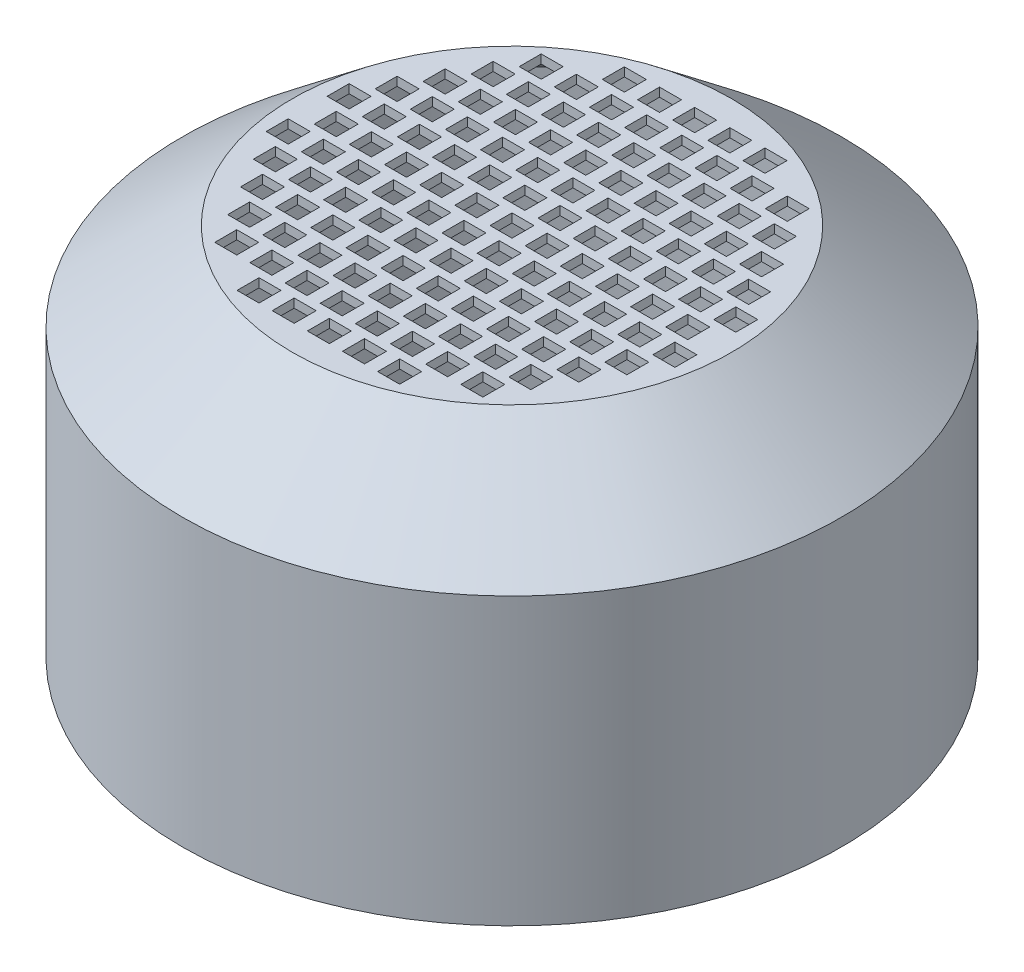
from build123d import *

# Parameters (mm, degrees)
SKETCH1_R               = 1905
BOSS_EXTRUDE1_DEPTH     = 2159
CHAMFER1_SIZE           = 508
CHAMFER1_SIZE2          = 635
SHELL1_T                = -50.8
SKETCH2_W               = 127
SKETCH2_H               = 127
CUT_EXTRUDE1_DEPTH      = 3453.438413643
FILL_START              = 2108.2
FILL_PATTERN1_OUTLINE_W = 127
FILL_PATTERN1_OUTLINE_H = 127
FILL_PATTERN1_DEPTH     = 50.8
EXTRUDE_THIN1_REACH     = 3454.438
SKETCH3_R               = 1689.1
SKETCH3_R_2             = 1651
SCALE1_SCALE            = 0.02


# Read off the part's stored shape, not the designer's step: Fill Pattern1
with BuildPart() as part:
    # Sketch1 → Boss-Extrude1 (new body)
    with BuildSketch(Plane(origin=(0, 0, 0), x_dir=(1, 0, 0), z_dir=(0, 1, 0))):
        with Locations(Location((0, 0, 0), (0, 0, 270))):
            Circle(SKETCH1_R)
    extrude(amount=BOSS_EXTRUDE1_DEPTH)

    # Chamfer1
    chamfer1_edges = [part.edges().sort_by_distance(p)[0] for p in [
        (0, 2159, -1905),
    ]]
    chamfer1_side = [part.faces().sort_by_distance(p)[0] for p in [
        (0, 1079.5, -1905),
    ]]
    chamfer(chamfer1_edges, length=CHAMFER1_SIZE, length2=CHAMFER1_SIZE2, reference=chamfer1_side[0])

    # Shell1
    shell1_openings = [part.faces().sort_by_distance(p)[0] for p in [
        (0, 0, 0),
    ]]
    offset(amount=SHELL1_T, openings=shell1_openings, kind=Kind.INTERSECTION)

    # Sketch2 → Cut-Extrude1 (cut, through all)
    with BuildSketch(Plane(origin=(0, 2159, 0), x_dir=(1, 0, 0), z_dir=(0, 1, 0))):
        Rectangle(SKETCH2_W, SKETCH2_H)
    extrude(amount=-CUT_EXTRUDE1_DEPTH, mode=Mode.SUBTRACT)

    # Fill Pattern1 outline → Fill Pattern1 (cut)
    with BuildSketch(Plane(origin=(0, 0, 0), x_dir=(1, 0, 0), z_dir=(0, 1, 0)).offset(FILL_START)):
        with Locations((0, 1055.858172294)):
            Rectangle(FILL_PATTERN1_OUTLINE_W, FILL_PATTERN1_OUTLINE_H)
        with Locations((0, 351.952724098)):
            Rectangle(FILL_PATTERN1_OUTLINE_W, FILL_PATTERN1_OUTLINE_H)
        with Locations((0, 703.905448196)):
            Rectangle(FILL_PATTERN1_OUTLINE_W, FILL_PATTERN1_OUTLINE_H)
        with Locations((0, -1055.858172294)):
            Rectangle(FILL_PATTERN1_OUTLINE_W, FILL_PATTERN1_OUTLINE_H)
        with Locations((0, -351.952724098)):
            Rectangle(FILL_PATTERN1_OUTLINE_W, FILL_PATTERN1_OUTLINE_H)
        with Locations((0, -703.905448196)):
            Rectangle(FILL_PATTERN1_OUTLINE_W, FILL_PATTERN1_OUTLINE_H)
        with Locations((-406.4, 0)):
            Rectangle(FILL_PATTERN1_OUTLINE_W, FILL_PATTERN1_OUTLINE_H)
        with Locations((-609.6, 0)):
            Rectangle(FILL_PATTERN1_OUTLINE_W, FILL_PATTERN1_OUTLINE_H)
        with Locations((-203.2, 0)):
            Rectangle(FILL_PATTERN1_OUTLINE_W, FILL_PATTERN1_OUTLINE_H)
        with Locations((-1016, 0)):
            Rectangle(FILL_PATTERN1_OUTLINE_W, FILL_PATTERN1_OUTLINE_H)
        with Locations((-812.8, 0)):
            Rectangle(FILL_PATTERN1_OUTLINE_W, FILL_PATTERN1_OUTLINE_H)
        with Locations((609.6, 0)):
            Rectangle(FILL_PATTERN1_OUTLINE_W, FILL_PATTERN1_OUTLINE_H)
        with Locations((1016, 0)):
            Rectangle(FILL_PATTERN1_OUTLINE_W, FILL_PATTERN1_OUTLINE_H)
        with Locations((812.8, 0)):
            Rectangle(FILL_PATTERN1_OUTLINE_W, FILL_PATTERN1_OUTLINE_H)
        with Locations((406.4, 0)):
            Rectangle(FILL_PATTERN1_OUTLINE_W, FILL_PATTERN1_OUTLINE_H)
        with Locations((203.2, 0)):
            Rectangle(FILL_PATTERN1_OUTLINE_W, FILL_PATTERN1_OUTLINE_H)
        with Locations((1117.6, -175.976362049)):
            Rectangle(FILL_PATTERN1_OUTLINE_W, FILL_PATTERN1_OUTLINE_H)
        with Locations((1117.6, 175.976362049)):
            Rectangle(FILL_PATTERN1_OUTLINE_W, FILL_PATTERN1_OUTLINE_H)
        with Locations((-508, -175.976362049)):
            Rectangle(FILL_PATTERN1_OUTLINE_W, FILL_PATTERN1_OUTLINE_H)
        with Locations((-711.2, -175.976362049)):
            Rectangle(FILL_PATTERN1_OUTLINE_W, FILL_PATTERN1_OUTLINE_H)
        with Locations((-304.8, -175.976362049)):
            Rectangle(FILL_PATTERN1_OUTLINE_W, FILL_PATTERN1_OUTLINE_H)
        with Locations((-1117.6, -175.976362049)):
            Rectangle(FILL_PATTERN1_OUTLINE_W, FILL_PATTERN1_OUTLINE_H)
        with Locations((-914.4, -175.976362049)):
            Rectangle(FILL_PATTERN1_OUTLINE_W, FILL_PATTERN1_OUTLINE_H)
        with Locations((508, -175.976362049)):
            Rectangle(FILL_PATTERN1_OUTLINE_W, FILL_PATTERN1_OUTLINE_H)
        with Locations((914.4, -175.976362049)):
            Rectangle(FILL_PATTERN1_OUTLINE_W, FILL_PATTERN1_OUTLINE_H)
        with Locations((711.2, -175.976362049)):
            Rectangle(FILL_PATTERN1_OUTLINE_W, FILL_PATTERN1_OUTLINE_H)
        with Locations((101.6, -175.976362049)):
            Rectangle(FILL_PATTERN1_OUTLINE_W, FILL_PATTERN1_OUTLINE_H)
        with Locations((-101.6, -175.976362049)):
            Rectangle(FILL_PATTERN1_OUTLINE_W, FILL_PATTERN1_OUTLINE_H)
        with Locations((304.8, -175.976362049)):
            Rectangle(FILL_PATTERN1_OUTLINE_W, FILL_PATTERN1_OUTLINE_H)
        with Locations((-609.6, -351.952724098)):
            Rectangle(FILL_PATTERN1_OUTLINE_W, FILL_PATTERN1_OUTLINE_H)
        with Locations((-609.6, -703.905448196)):
            Rectangle(FILL_PATTERN1_OUTLINE_W, FILL_PATTERN1_OUTLINE_H)
        with Locations((-609.6, 351.952724098)):
            Rectangle(FILL_PATTERN1_OUTLINE_W, FILL_PATTERN1_OUTLINE_H)
        with Locations((-609.6, 703.905448196)):
            Rectangle(FILL_PATTERN1_OUTLINE_W, FILL_PATTERN1_OUTLINE_H)
        with Locations((-812.8, -351.952724098)):
            Rectangle(FILL_PATTERN1_OUTLINE_W, FILL_PATTERN1_OUTLINE_H)
        with Locations((-406.4, -351.952724098)):
            Rectangle(FILL_PATTERN1_OUTLINE_W, FILL_PATTERN1_OUTLINE_H)
        with Locations((-1016, -351.952724098)):
            Rectangle(FILL_PATTERN1_OUTLINE_W, FILL_PATTERN1_OUTLINE_H)
        with Locations((609.6, -351.952724098)):
            Rectangle(FILL_PATTERN1_OUTLINE_W, FILL_PATTERN1_OUTLINE_H)
        with Locations((406.4, -351.952724098)):
            Rectangle(FILL_PATTERN1_OUTLINE_W, FILL_PATTERN1_OUTLINE_H)
        with Locations((812.8, -351.952724098)):
            Rectangle(FILL_PATTERN1_OUTLINE_W, FILL_PATTERN1_OUTLINE_H)
        with Locations((1016, -351.952724098)):
            Rectangle(FILL_PATTERN1_OUTLINE_W, FILL_PATTERN1_OUTLINE_H)
        with Locations((-203.2, -351.952724098)):
            Rectangle(FILL_PATTERN1_OUTLINE_W, FILL_PATTERN1_OUTLINE_H)
        with Locations((203.2, -351.952724098)):
            Rectangle(FILL_PATTERN1_OUTLINE_W, FILL_PATTERN1_OUTLINE_H)
        with Locations((-711.2, -527.929086147)):
            Rectangle(FILL_PATTERN1_OUTLINE_W, FILL_PATTERN1_OUTLINE_H)
        with Locations((-711.2, -879.881810245)):
            Rectangle(FILL_PATTERN1_OUTLINE_W, FILL_PATTERN1_OUTLINE_H)
        with Locations((-711.2, 879.881810245)):
            Rectangle(FILL_PATTERN1_OUTLINE_W, FILL_PATTERN1_OUTLINE_H)
        with Locations((-711.2, 175.976362049)):
            Rectangle(FILL_PATTERN1_OUTLINE_W, FILL_PATTERN1_OUTLINE_H)
        with Locations((-711.2, 527.929086147)):
            Rectangle(FILL_PATTERN1_OUTLINE_W, FILL_PATTERN1_OUTLINE_H)
        with Locations((-508, -527.929086147)):
            Rectangle(FILL_PATTERN1_OUTLINE_W, FILL_PATTERN1_OUTLINE_H)
        with Locations((-914.4, -527.929086147)):
            Rectangle(FILL_PATTERN1_OUTLINE_W, FILL_PATTERN1_OUTLINE_H)
        with Locations((508, -527.929086147)):
            Rectangle(FILL_PATTERN1_OUTLINE_W, FILL_PATTERN1_OUTLINE_H)
        with Locations((304.8, -527.929086147)):
            Rectangle(FILL_PATTERN1_OUTLINE_W, FILL_PATTERN1_OUTLINE_H)
        with Locations((914.4, -527.929086147)):
            Rectangle(FILL_PATTERN1_OUTLINE_W, FILL_PATTERN1_OUTLINE_H)
        with Locations((711.2, -527.929086147)):
            Rectangle(FILL_PATTERN1_OUTLINE_W, FILL_PATTERN1_OUTLINE_H)
        with Locations((-101.6, -527.929086147)):
            Rectangle(FILL_PATTERN1_OUTLINE_W, FILL_PATTERN1_OUTLINE_H)
        with Locations((-304.8, -527.929086147)):
            Rectangle(FILL_PATTERN1_OUTLINE_W, FILL_PATTERN1_OUTLINE_H)
        with Locations((101.6, -527.929086147)):
            Rectangle(FILL_PATTERN1_OUTLINE_W, FILL_PATTERN1_OUTLINE_H)
        with Locations((-812.8, -703.905448196)):
            Rectangle(FILL_PATTERN1_OUTLINE_W, FILL_PATTERN1_OUTLINE_H)
        with Locations((-812.8, 703.905448196)):
            Rectangle(FILL_PATTERN1_OUTLINE_W, FILL_PATTERN1_OUTLINE_H)
        with Locations((-812.8, 351.952724098)):
            Rectangle(FILL_PATTERN1_OUTLINE_W, FILL_PATTERN1_OUTLINE_H)
        with Locations((406.4, -703.905448196)):
            Rectangle(FILL_PATTERN1_OUTLINE_W, FILL_PATTERN1_OUTLINE_H)
        with Locations((203.2, -703.905448196)):
            Rectangle(FILL_PATTERN1_OUTLINE_W, FILL_PATTERN1_OUTLINE_H)
        with Locations((812.8, -703.905448196)):
            Rectangle(FILL_PATTERN1_OUTLINE_W, FILL_PATTERN1_OUTLINE_H)
        with Locations((609.6, -703.905448196)):
            Rectangle(FILL_PATTERN1_OUTLINE_W, FILL_PATTERN1_OUTLINE_H)
        with Locations((-203.2, -703.905448196)):
            Rectangle(FILL_PATTERN1_OUTLINE_W, FILL_PATTERN1_OUTLINE_H)
        with Locations((-406.4, -703.905448196)):
            Rectangle(FILL_PATTERN1_OUTLINE_W, FILL_PATTERN1_OUTLINE_H)
        with Locations((406.4, 1055.858172294)):
            Rectangle(FILL_PATTERN1_OUTLINE_W, FILL_PATTERN1_OUTLINE_H)
        with Locations((203.2, 1055.858172294)):
            Rectangle(FILL_PATTERN1_OUTLINE_W, FILL_PATTERN1_OUTLINE_H)
        with Locations((-203.2, 1055.858172294)):
            Rectangle(FILL_PATTERN1_OUTLINE_W, FILL_PATTERN1_OUTLINE_H)
        with Locations((-406.4, 1055.858172294)):
            Rectangle(FILL_PATTERN1_OUTLINE_W, FILL_PATTERN1_OUTLINE_H)
        with Locations((-508, 175.976362049)):
            Rectangle(FILL_PATTERN1_OUTLINE_W, FILL_PATTERN1_OUTLINE_H)
        with Locations((-508, 527.929086147)):
            Rectangle(FILL_PATTERN1_OUTLINE_W, FILL_PATTERN1_OUTLINE_H)
        with Locations((-508, 879.881810245)):
            Rectangle(FILL_PATTERN1_OUTLINE_W, FILL_PATTERN1_OUTLINE_H)
        with Locations((-508, -879.881810245)):
            Rectangle(FILL_PATTERN1_OUTLINE_W, FILL_PATTERN1_OUTLINE_H)
        with Locations((-406.4, 351.952724098)):
            Rectangle(FILL_PATTERN1_OUTLINE_W, FILL_PATTERN1_OUTLINE_H)
        with Locations((-406.4, 703.905448196)):
            Rectangle(FILL_PATTERN1_OUTLINE_W, FILL_PATTERN1_OUTLINE_H)
        with Locations((-406.4, -1055.858172294)):
            Rectangle(FILL_PATTERN1_OUTLINE_W, FILL_PATTERN1_OUTLINE_H)
        with Locations((-304.8, 175.976362049)):
            Rectangle(FILL_PATTERN1_OUTLINE_W, FILL_PATTERN1_OUTLINE_H)
        with Locations((-304.8, 527.929086147)):
            Rectangle(FILL_PATTERN1_OUTLINE_W, FILL_PATTERN1_OUTLINE_H)
        with Locations((-304.8, 879.881810245)):
            Rectangle(FILL_PATTERN1_OUTLINE_W, FILL_PATTERN1_OUTLINE_H)
        with Locations((-304.8, -879.881810245)):
            Rectangle(FILL_PATTERN1_OUTLINE_W, FILL_PATTERN1_OUTLINE_H)
        with Locations((-101.6, 175.976362049)):
            Rectangle(FILL_PATTERN1_OUTLINE_W, FILL_PATTERN1_OUTLINE_H)
        with Locations((-1117.6, 175.976362049)):
            Rectangle(FILL_PATTERN1_OUTLINE_W, FILL_PATTERN1_OUTLINE_H)
        with Locations((-914.4, 175.976362049)):
            Rectangle(FILL_PATTERN1_OUTLINE_W, FILL_PATTERN1_OUTLINE_H)
        with Locations((711.2, 175.976362049)):
            Rectangle(FILL_PATTERN1_OUTLINE_W, FILL_PATTERN1_OUTLINE_H)
        with Locations((914.4, 175.976362049)):
            Rectangle(FILL_PATTERN1_OUTLINE_W, FILL_PATTERN1_OUTLINE_H)
        with Locations((101.6, 175.976362049)):
            Rectangle(FILL_PATTERN1_OUTLINE_W, FILL_PATTERN1_OUTLINE_H)
        with Locations((508, 175.976362049)):
            Rectangle(FILL_PATTERN1_OUTLINE_W, FILL_PATTERN1_OUTLINE_H)
        with Locations((304.8, 175.976362049)):
            Rectangle(FILL_PATTERN1_OUTLINE_W, FILL_PATTERN1_OUTLINE_H)
        with Locations((-203.2, 351.952724098)):
            Rectangle(FILL_PATTERN1_OUTLINE_W, FILL_PATTERN1_OUTLINE_H)
        with Locations((-203.2, 703.905448196)):
            Rectangle(FILL_PATTERN1_OUTLINE_W, FILL_PATTERN1_OUTLINE_H)
        with Locations((-203.2, -1055.858172294)):
            Rectangle(FILL_PATTERN1_OUTLINE_W, FILL_PATTERN1_OUTLINE_H)
        with Locations((-1016, 351.952724098)):
            Rectangle(FILL_PATTERN1_OUTLINE_W, FILL_PATTERN1_OUTLINE_H)
        with Locations((812.8, 351.952724098)):
            Rectangle(FILL_PATTERN1_OUTLINE_W, FILL_PATTERN1_OUTLINE_H)
        with Locations((1016, 351.952724098)):
            Rectangle(FILL_PATTERN1_OUTLINE_W, FILL_PATTERN1_OUTLINE_H)
        with Locations((203.2, 351.952724098)):
            Rectangle(FILL_PATTERN1_OUTLINE_W, FILL_PATTERN1_OUTLINE_H)
        with Locations((609.6, 351.952724098)):
            Rectangle(FILL_PATTERN1_OUTLINE_W, FILL_PATTERN1_OUTLINE_H)
        with Locations((406.4, 351.952724098)):
            Rectangle(FILL_PATTERN1_OUTLINE_W, FILL_PATTERN1_OUTLINE_H)
        with Locations((-101.6, 879.881810245)):
            Rectangle(FILL_PATTERN1_OUTLINE_W, FILL_PATTERN1_OUTLINE_H)
        with Locations((-101.6, 527.929086147)):
            Rectangle(FILL_PATTERN1_OUTLINE_W, FILL_PATTERN1_OUTLINE_H)
        with Locations((-101.6, -879.881810245)):
            Rectangle(FILL_PATTERN1_OUTLINE_W, FILL_PATTERN1_OUTLINE_H)
        with Locations((304.8, 879.881810245)):
            Rectangle(FILL_PATTERN1_OUTLINE_W, FILL_PATTERN1_OUTLINE_H)
        with Locations((101.6, 879.881810245)):
            Rectangle(FILL_PATTERN1_OUTLINE_W, FILL_PATTERN1_OUTLINE_H)
        with Locations((508, 879.881810245)):
            Rectangle(FILL_PATTERN1_OUTLINE_W, FILL_PATTERN1_OUTLINE_H)
        with Locations((711.2, 879.881810245)):
            Rectangle(FILL_PATTERN1_OUTLINE_W, FILL_PATTERN1_OUTLINE_H)
        with Locations((203.2, 703.905448196)):
            Rectangle(FILL_PATTERN1_OUTLINE_W, FILL_PATTERN1_OUTLINE_H)
        with Locations((812.8, 703.905448196)):
            Rectangle(FILL_PATTERN1_OUTLINE_W, FILL_PATTERN1_OUTLINE_H)
        with Locations((406.4, 703.905448196)):
            Rectangle(FILL_PATTERN1_OUTLINE_W, FILL_PATTERN1_OUTLINE_H)
        with Locations((609.6, 703.905448196)):
            Rectangle(FILL_PATTERN1_OUTLINE_W, FILL_PATTERN1_OUTLINE_H)
        with Locations((101.6, 527.929086147)):
            Rectangle(FILL_PATTERN1_OUTLINE_W, FILL_PATTERN1_OUTLINE_H)
        with Locations((-914.4, 527.929086147)):
            Rectangle(FILL_PATTERN1_OUTLINE_W, FILL_PATTERN1_OUTLINE_H)
        with Locations((914.4, 527.929086147)):
            Rectangle(FILL_PATTERN1_OUTLINE_W, FILL_PATTERN1_OUTLINE_H)
        with Locations((304.8, 527.929086147)):
            Rectangle(FILL_PATTERN1_OUTLINE_W, FILL_PATTERN1_OUTLINE_H)
        with Locations((711.2, 527.929086147)):
            Rectangle(FILL_PATTERN1_OUTLINE_W, FILL_PATTERN1_OUTLINE_H)
        with Locations((508, 527.929086147)):
            Rectangle(FILL_PATTERN1_OUTLINE_W, FILL_PATTERN1_OUTLINE_H)
        with Locations((406.4, -1055.858172294)):
            Rectangle(FILL_PATTERN1_OUTLINE_W, FILL_PATTERN1_OUTLINE_H)
        with Locations((304.8, -879.881810245)):
            Rectangle(FILL_PATTERN1_OUTLINE_W, FILL_PATTERN1_OUTLINE_H)
        with Locations((203.2, -1055.858172294)):
            Rectangle(FILL_PATTERN1_OUTLINE_W, FILL_PATTERN1_OUTLINE_H)
        with Locations((101.6, -879.881810245)):
            Rectangle(FILL_PATTERN1_OUTLINE_W, FILL_PATTERN1_OUTLINE_H)
        with Locations((711.2, -879.881810245)):
            Rectangle(FILL_PATTERN1_OUTLINE_W, FILL_PATTERN1_OUTLINE_H)
        with Locations((508, -879.881810245)):
            Rectangle(FILL_PATTERN1_OUTLINE_W, FILL_PATTERN1_OUTLINE_H)
    extrude(amount=FILL_PATTERN1_DEPTH, mode=Mode.SUBTRACT)

    # Extrude-Thin1: up to this cone (the profile starts inside it)
    extrude_thin1_end = Plane(origin=(0, 0, 0), z_dir=(0, -1, 0)).offset(-3109.944256748) * Cone(1.25e-06, 13065.390724915, 10452.312578932, align=(Align.CENTER, Align.CENTER, Align.MIN), mode=Mode.PRIVATE)
    # Sketch3 → Extrude-Thin1 (add, up to the surface)
    with BuildSketch(Plane.XZ, mode=Mode.PRIVATE) as extrude_thin1_sk1:
        Circle(SKETCH3_R)
        Circle(SKETCH3_R_2, mode=Mode.SUBTRACT)
    extrude_thin1_tool1 = extrude(extrude_thin1_sk1.sketch, amount=-EXTRUDE_THIN1_REACH, mode=Mode.PRIVATE) & extrude_thin1_end
    add(extrude_thin1_tool1.solids().sort_by_distance((-1684.322504, 0, 0))[0])


with BuildPart() as part_1:
    # Scale1: scaled about (0, 1117.270900847, 0)
    add(part.part.scale(SCALE1_SCALE).moved(Location((0, 1094.92548283, 0))))


solid = part_1.part
